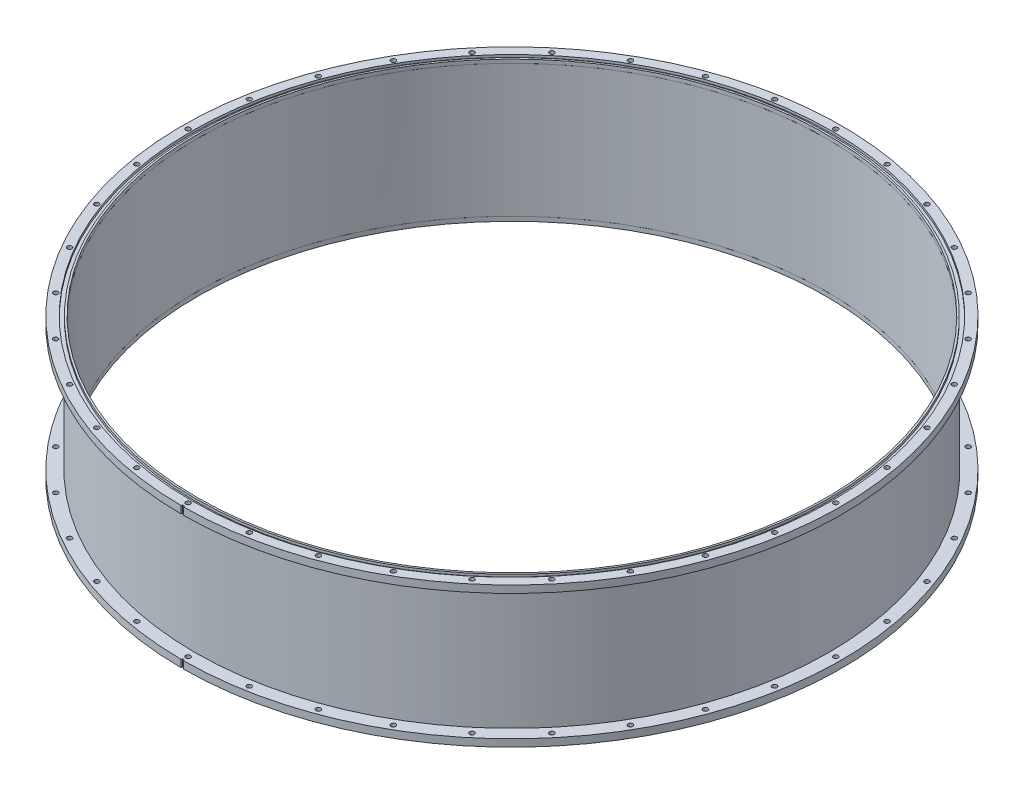
from build123d import *

# Parameters (mm, degrees)
EXTRUDE_THIN_CYLINDER_BODY_REACH             = 1055.393
SKETCH3_R                                    = 687.26249998
SKETCH3_R_2                                  = 682.49999998
TAPPED_START                                 = 288.925
TAPPED_HOLE_FOR_3_8_16_HELICOIL_FR_2_R       = 5.0419
TAPPED_HOLE_FOR_3_8_16_HELICOIL_FROM_H_DEPTH = 15.875
SKETCH7_W                                    = 5.15874
SKETCH7_H                                    = 15.875
SKETCH8_W                                    = 5.08
SKETCH8_H                                    = 304.8
CUT_EXTRUDE_ALIGNMENT_MARK_DEPTH             = 2.54
CIRPATTERN_HOLE_PATTERN_COUNT                = 36


# Read off the part's stored shape, not the designer's step: Tapped Hole for 3/8-16 Helicoil - from HDPE Tophat
with BuildPart() as part:
    # Sketch1 → Revolve - Flange to RT Plate (revolve)
    with BuildSketch(Plane.XY, mode=Mode.PRIVATE) as revolve_flange_to_rt_plate_sk:
        Polygon((-682.49999998, 0), (-682.49999998, 9.525), (-687.26249998, 9.525), (-687.26249998, 15.875), (-715, 15.875), (-715, 0), align=None)
    revolve(revolve_flange_to_rt_plate_sk.sketch.rotate(Axis((0, 57.350368034, 0), (0, -1, 0)), 270), axis=Axis((0, 57.350368034, 0), (0, -1, 0)))

    # Sketch7 → 3/8 Clearance Hole - to RT_PF (revolve, cut)
    with BuildSketch(Plane(origin=(0, 15.875, 702.5), x_dir=(0, 0, 1), z_dir=(1, 0, 0))):
        with Locations((2.57937, 7.9375)):
            Rectangle(SKETCH7_W, SKETCH7_H)
    f_3_8_clearance_hole_to_rt_pf = revolve(axis=Axis((0, 22.225, 702.5), (0, -1, 0)), mode=Mode.SUBTRACT)


with BuildPart() as body_2:
    # Sketch2 → Revolve - Flange to HDPE (revolve)
    with BuildSketch(Plane.XY, mode=Mode.PRIVATE) as revolve_flange_to_hdpe_sk:
        Polygon((-682.5, 304.8), (-686.5, 304.8), (-686.5, 299.56125), (-694.53275, 299.56125), (-694.53275, 304.8), (-715, 304.8), (-715, 288.925), (-686.5, 288.925), (-686.5, 296.8625), (-682.5, 296.8625), align=None)
    revolve(revolve_flange_to_hdpe_sk.sketch.rotate(Axis((0, 57.350368034, 0), (0, -1, 0)), 270), axis=Axis((0, 57.350368034, 0), (0, -1, 0)))


with BuildPart() as body_3:

    # Sketch3 → Extrude-Thin - Cylinder Body (new, up to next)
    with BuildSketch(Plane(origin=(0, 9.525, 0), x_dir=(1, 0, 0), z_dir=(0, 1, 0)), mode=Mode.PRIVATE) as extrude_thin_cylinder_body_sk1:
        Circle(SKETCH3_R)
        Circle(SKETCH3_R_2, mode=Mode.SUBTRACT)
    extrude_thin_cylinder_body_tool1 = extrude(extrude_thin_cylinder_body_sk1.sketch, amount=EXTRUDE_THIN_CYLINDER_BODY_REACH, mode=Mode.PRIVATE) - body_2.part
    add(extrude_thin_cylinder_body_tool1.solids().sort_by_distance((-685.318628, 9.525, 0))[0])


with BuildPart() as body_2_1:
    add(body_2.part)

    # Tapped Hole for 3_8-16 Helicoil - fr 2 → Tapped Hole for 3/8-16 Helicoil - from HDPE Tophat (cut)
    with BuildSketch(Plane(origin=(0, 0, 0), x_dir=(1, 0, 0), z_dir=(0, 1, 0)).offset(TAPPED_START)):
        with Locations((0, -702.5)):
            Circle(TAPPED_HOLE_FOR_3_8_16_HELICOIL_FR_2_R)
    tapped_hole_for_3_8_16_helicoil_from_h = extrude(amount=TAPPED_HOLE_FOR_3_8_16_HELICOIL_FROM_H_DEPTH, mode=Mode.SUBTRACT)


with BuildPart() as cut_extrude_alignment_mark_tool:
    # Sketch8 → Cut-Extrude - Alignment Mark (new body)
    with BuildSketch(Plane.XY.offset(715)):
        with Locations((0, 152.4)):
            Rectangle(SKETCH8_W, SKETCH8_H)
    extrude(amount=-CUT_EXTRUDE_ALIGNMENT_MARK_DEPTH)


with BuildPart() as part_1:
    add(part.part)

    # Cut-Extrude - Alignment Mark: cut by cut_extrude_alignment_mark_tool
    add(cut_extrude_alignment_mark_tool.part, mode=Mode.SUBTRACT)


with BuildPart() as body_2_2:
    add(body_2_1.part)

    # Cut-Extrude - Alignment Mark: cut by cut_extrude_alignment_mark_tool
    add(cut_extrude_alignment_mark_tool.part, mode=Mode.SUBTRACT)


with BuildPart() as cirpattern_hole_pattern_tool:
    # CirPattern - Hole Pattern: Tapped Hole for 3/8-16 Helicoil - from HDPE Tophat, 3/8 Clearance Hole - to RT_PF ×36 about axis
    cirpattern_hole_pattern_axis = Axis((0, 0, 0), (0, 1, 0))
    add([tapped_hole_for_3_8_16_helicoil_from_h.rotate(cirpattern_hole_pattern_axis, i * 360 / CIRPATTERN_HOLE_PATTERN_COUNT) for i in range(1, CIRPATTERN_HOLE_PATTERN_COUNT)])
    add([f_3_8_clearance_hole_to_rt_pf.rotate(cirpattern_hole_pattern_axis, i * 360 / CIRPATTERN_HOLE_PATTERN_COUNT) for i in range(1, CIRPATTERN_HOLE_PATTERN_COUNT)])


with BuildPart() as part_2:
    add(part_1.part)

    # CirPattern - Hole Pattern: cut by cirpattern_hole_pattern_tool
    add(cirpattern_hole_pattern_tool.part, mode=Mode.SUBTRACT)


with BuildPart() as body_2_3:
    add(body_2_2.part)

    # CirPattern - Hole Pattern: cut by cirpattern_hole_pattern_tool
    add(cirpattern_hole_pattern_tool.part, mode=Mode.SUBTRACT)


solid = Compound([body_3.part, part_2.part, body_2_3.part])
